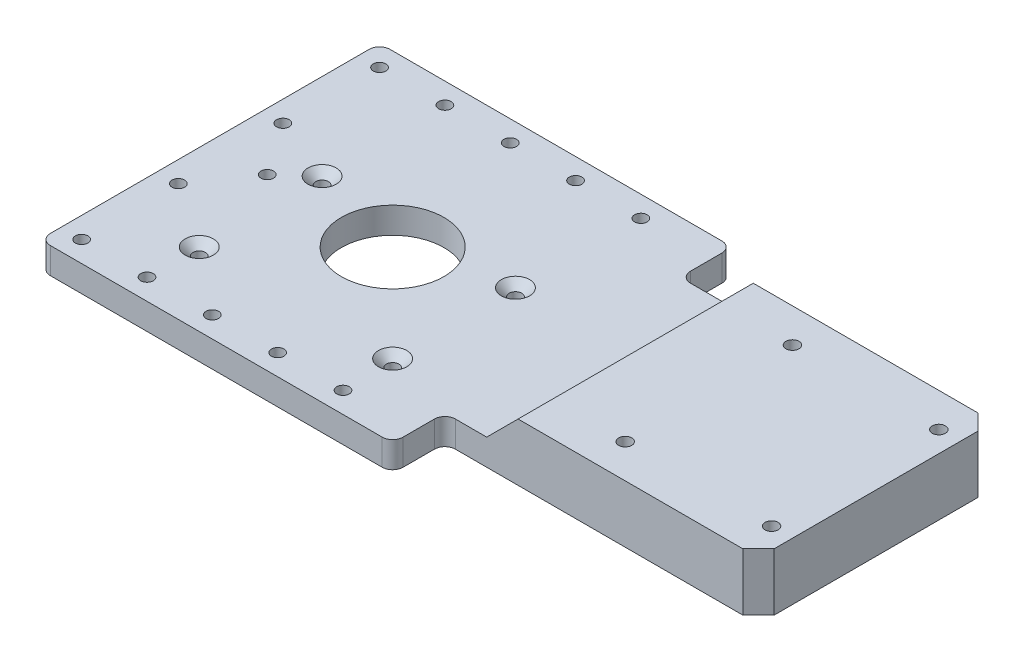
from build123d import *

# Parameters (mm, degrees)
SKETCH1_W                                           = 115
SKETCH1_H                                           = 45
BOSS_EXTRUDE1_DEPTH                                 = 5
CUT_EXTRUDE1_REACH                                  = 119.287
SKETCH2_R                                           = 9.8171
CSK_FOR_M2_COUNTERSUNK_FLAT_HEAD_SCREW1_D           = 2.4
CSK_FOR_M2_COUNTERSUNK_FLAT_HEAD_SCREW1_CSINK_D     = 5.4
CSK_FOR_M2_COUNTERSUNK_FLAT_HEAD_SCREW1_CSINK_ANGLE = 90
SKETCH13_W                                          = 52
SKETCH13_H                                          = 45
BOSS_EXTRUDE4_DEPTH                                 = 6
CHAMFER2_SIZE                                       = 6
M3_TAPPED_HOLE1_D                                   = 2.5
CHAMFER1_SIZE                                       = 3
SKETCH14_W                                          = 12.5
SKETCH14_H                                          = 30
BOSS_EXTRUDE5_DEPTH                                 = 5
BOSS_EXTRUDE6_DEPTH                                 = 5
FILLET1_R                                           = 2
CSK_FOR_M2_COUNTERSUNK_FLAT_HEAD_SCREW2_D           = 2.4
CSK_FOR_M2_COUNTERSUNK_FLAT_HEAD_SCREW2_DEPTH       = 5
CSK_FOR_M2_COUNTERSUNK_FLAT_HEAD_SCREW2_CSINK_D     = 5.4
CSK_FOR_M2_COUNTERSUNK_FLAT_HEAD_SCREW2_CSINK_ANGLE = 90
CSK_FOR_M2_COUNTERSUNK_FLAT_HEAD_SCREW2_TIP         = 0.721032743


with BuildPart() as part:
    # Sketch1 → Boss-Extrude1 (new body)
    with BuildSketch(Plane(origin=(0, 0, 0), x_dir=(1, 0, 0), z_dir=(0, 1, 0))):
        with Locations((57.5, 0)):
            Rectangle(SKETCH1_W, SKETCH1_H)
    extrude(amount=BOSS_EXTRUDE1_DEPTH)

    # Sketch2 → Cut-Extrude1 (cut, up to next)
    with BuildSketch(Plane(origin=(0, 5, 0), x_dir=(1, 0, 0), z_dir=(0, 1, 0)), mode=Mode.PRIVATE) as cut_extrude1_sk1:
        with Locations(Location((22.5, 0, 0), (0, 0, 270))):
            Circle(SKETCH2_R)
    cut_extrude1_tool1 = extrude(cut_extrude1_sk1.sketch, amount=-CUT_EXTRUDE1_REACH, mode=Mode.PRIVATE) & part.part
    add(cut_extrude1_tool1.solids().sort_by_distance((22.5, 5, 0))[0], mode=Mode.SUBTRACT)

    # CSK for M2 Countersunk Flat Head Screw1 (through all)
    with Locations(Plane(origin=(0, 5, 0), x_dir=(1, 0, 0), z_dir=(0, 1, 0))):
        with Locations((4, -18.5), (41, -18.5), (41, 5), (4, 5)):
            CounterSinkHole(CSK_FOR_M2_COUNTERSUNK_FLAT_HEAD_SCREW1_D / 2, CSK_FOR_M2_COUNTERSUNK_FLAT_HEAD_SCREW1_CSINK_D / 2, counter_sink_angle=CSK_FOR_M2_COUNTERSUNK_FLAT_HEAD_SCREW1_CSINK_ANGLE)

    # Sketch13 → Boss-Extrude4 (add)
    with BuildSketch(Plane(origin=(0, 5, 0), x_dir=(1, 0, 0), z_dir=(0, 1, 0))):
        with Locations((89, 0)):
            Rectangle(SKETCH13_W, SKETCH13_H)
    extrude(amount=BOSS_EXTRUDE4_DEPTH)

    # Chamfer2
    chamfer2_edges = [part.edges().sort_by_distance(p)[0] for p in [
        (63, 11, 0),
    ]]
    chamfer(chamfer2_edges, length=CHAMFER2_SIZE - 0.0001)  # a hair under: the kernel refuses the full size

    # M3 Tapped Hole1 (through all)
    with Locations(Plane(origin=(0, 11, 0), x_dir=(1, 0, 0), z_dir=(0, 1, 0))):
        with Locations((83, 16), (111, 16), (83, -16), (111, -16)):
            Hole(M3_TAPPED_HOLE1_D / 2)

    # Chamfer1
    chamfer1_edges = [part.edges().sort_by_distance(p)[0] for p in [
        (115, 5.5, -22.5),
        (115, 5.5, 22.5),
    ]]
    chamfer(chamfer1_edges, length=CHAMFER1_SIZE)

    # Sketch14 → Boss-Extrude5 (add)
    with BuildSketch(Plane(origin=(0, 0, 0), x_dir=(1, 0, 0), z_dir=(0, 1, 0))):
        with Locations((-6.25, 0)):
            Rectangle(SKETCH14_W, SKETCH14_H)
    extrude(amount=BOSS_EXTRUDE5_DEPTH)

    # Sketch17 → Boss-Extrude6 (add)
    with BuildSketch(Plane(origin=(0, 0, 0), x_dir=(1, 0, 0), z_dir=(0, 1, 0))):
        Polygon((-12.5, 15), (-12.5, 32.5), (55, 32.5), (55, 22.5), (0, 22.5), (0, 15), align=None)
        Polygon((-12.5, -15), (-12.5, -32.5), (55, -32.5), (55, -22.5), (0, -22.5), (0, -15), align=None)
    extrude(amount=BOSS_EXTRUDE6_DEPTH)

    # Fillet1
    fillet1_edges = [part.edges().sort_by_distance(p)[0] for p in [
        (55, 2.5, -22.5),
        (55, 2.5, -32.5),
        (-12.5, 2.5, -32.5),
        (-12.5, 2.5, 32.5),
        (55, 2.5, 32.5),
        (55, 2.5, 22.5),
    ]]
    fillet(fillet1_edges, radius=FILLET1_R)

    # CSK for M2 Countersunk Flat Head Screw2
    with Locations(Plane(origin=(0, 0, 0), x_dir=(-1, 0, 0), z_dir=(0, -1, 0))):
        with Locations((1.5, 0), (8.5, -10), (8.5, 10), (8.5, -28.5), (-4, -28.5), (-16.5, -28.5), (-41.5, -28.5), (-41.5, 28.5), (-29, 28.5), (-16.5, 28.5), (-4, 28.5), (8.5, 28.5), (-29, -28.5)):
            CounterSinkHole(CSK_FOR_M2_COUNTERSUNK_FLAT_HEAD_SCREW2_D / 2, CSK_FOR_M2_COUNTERSUNK_FLAT_HEAD_SCREW2_CSINK_D / 2, depth=CSK_FOR_M2_COUNTERSUNK_FLAT_HEAD_SCREW2_DEPTH, counter_sink_angle=CSK_FOR_M2_COUNTERSUNK_FLAT_HEAD_SCREW2_CSINK_ANGLE)
            with Locations((0, 0, -(CSK_FOR_M2_COUNTERSUNK_FLAT_HEAD_SCREW2_DEPTH + CSK_FOR_M2_COUNTERSUNK_FLAT_HEAD_SCREW2_TIP / 2))):  # 118° drill point
                Cone(0, CSK_FOR_M2_COUNTERSUNK_FLAT_HEAD_SCREW2_D / 2, CSK_FOR_M2_COUNTERSUNK_FLAT_HEAD_SCREW2_TIP, mode=Mode.SUBTRACT)


solid = part.part
